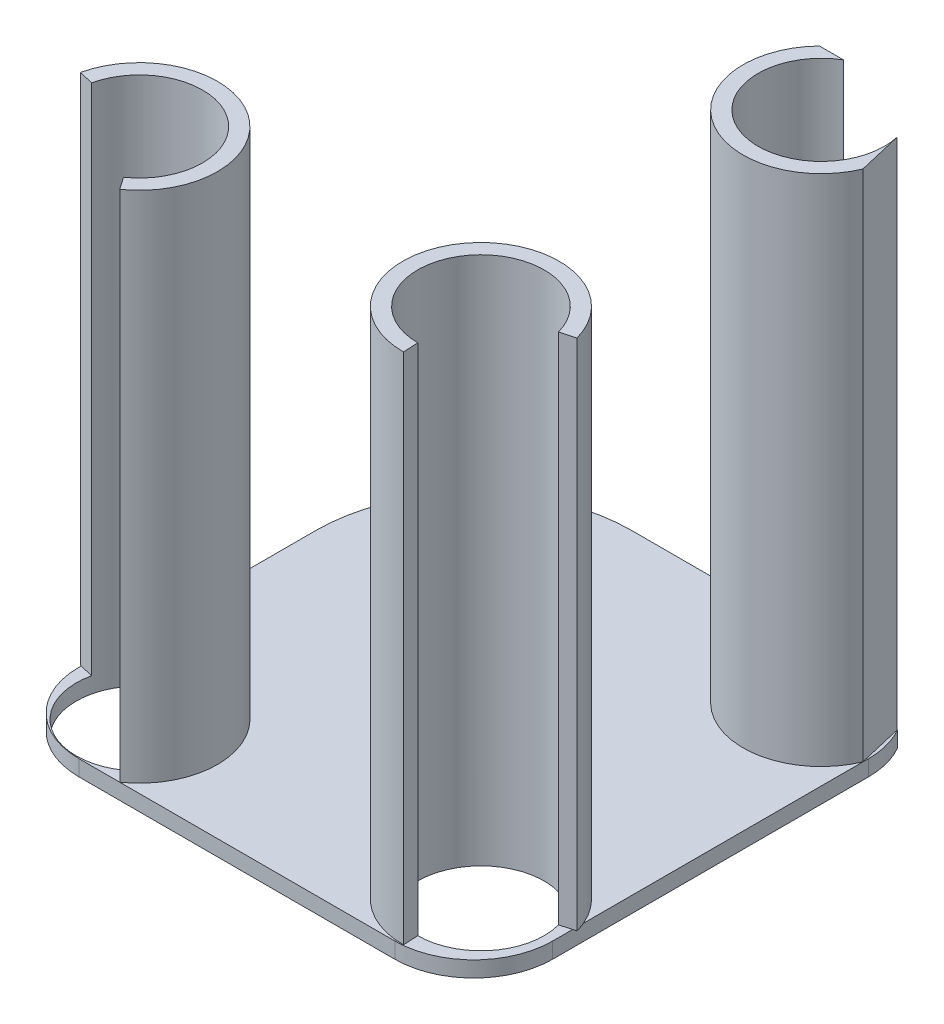
from build123d import *

# Parameters (mm, degrees)
BOSS_EXTRUDE1_DEPTH  = 2
BOSS_EXTRUDE9_DEPTH  = 65
SKETCH6_R            = 8
CUT_EXTRUDE3_DEPTH   = 78.787752397
SKETCH7_R            = 2
BOSS_EXTRUDE10_DEPTH = 10
SKETCH8_R            = 2
BOSS_EXTRUDE11_DEPTH = 10


with BuildPart() as part:
    # Sketch2 → Boss-Extrude1 (new body)
    with BuildSketch(Plane(origin=(0, 0, 0), x_dir=(1, 0, 0), z_dir=(0, 1, 0))):
        with BuildLine():
            Line((-10, 30), (20, 30))
            ThreePointArc((20, 30), (27.071067812, 27.071067812), (30, 20))
            Line((30, 20), (30, -20))
            ThreePointArc((30, -20), (27.071067812, -27.071067812), (20, -30))
            Line((20, -30), (-20, -30))
            ThreePointArc((-20, -30), (-27.071067812, -27.071067812), (-30, -20))
            Line((-30, -20), (-30, 10))
            ThreePointArc((-30, 10), (-24.142135624, 24.142135624), (-10, 30))
        make_face()
    extrude(amount=BOSS_EXTRUDE1_DEPTH)

    # Sketch5 → Boss-Extrude9 (add)
    with BuildSketch(Plane(origin=(0, 2, 0), x_dir=(1, 0, 0), z_dir=(0, 1, 0))):
        with BuildLine():
            Line((-30.116404199, -19.68082931), (-28.263425554, -20.100912803))
            ThreePointArc((-28.263425554, -20.100912803), (-15.988853518, -15.236719498), (-15.896791782, -28.439636592))
            Line((-15.896791782, -28.439636592), (-14.812694906, -30))
            ThreePointArc((-14.812694906, -30), (-14.926621305, -13.661390096), (-30.116404199, -19.68082931))
        make_face()
        with BuildLine():
            Line((20.977105182, -29.863851609), (20.875608793, -27.964371901))
            ThreePointArc((20.875608793, -27.964371901), (14.520196839, -15.105489427), (28.595658733, -17.866556627))
            Line((28.595658733, -17.866556627), (30.429170594, -17.368325499))
            ThreePointArc((30.429170594, -17.368325499), (12.980066991, -13.991900081), (20.977105182, -29.863851609))
        make_face()
        with BuildLine():
            Line((13.764397277, 30), (16.80629322, 30))
            ThreePointArc((16.80629322, 30), (17.733969491, 15.754964907), (28.664900588, 24.936269467))
            Line((28.664900588, 24.936269467), (29.994544588, 19.258061402))
            ThreePointArc((29.994544588, 19.258061402), (15.411631267, 14.856680059), (13.764397277, 30))
        make_face()
    extrude(amount=BOSS_EXTRUDE9_DEPTH)

    # Sketch6 → Cut-Extrude3 (cut, through all)
    with BuildSketch(Plane(origin=(0, 2, 0), x_dir=(1, 0, 0), z_dir=(0, 1, 0))):
        with Locations((20.875608793, 23.112281164)):
            Circle(SKETCH6_R)
        with Locations((-20.461410206, -21.869685402)):
            Circle(SKETCH6_R)
        with Locations((20.875608793, -19.964371901)):
            Circle(SKETCH6_R)
    extrude(amount=-CUT_EXTRUDE3_DEPTH, mode=Mode.SUBTRACT)

    # Sketch7 → Boss-Extrude10 (add)
    with BuildSketch(Plane.XZ):
        with Locations((6.600213653, -6.067854065)):
            Circle(SKETCH7_R)
    extrude(amount=BOSS_EXTRUDE10_DEPTH)

    # Sketch8 → Boss-Extrude11 (add)
    with BuildSketch(Plane.XZ):
        with Locations((-5.40151955, 9.120930292)):
            Circle(SKETCH8_R)
    extrude(amount=BOSS_EXTRUDE11_DEPTH)


solid = part.part
